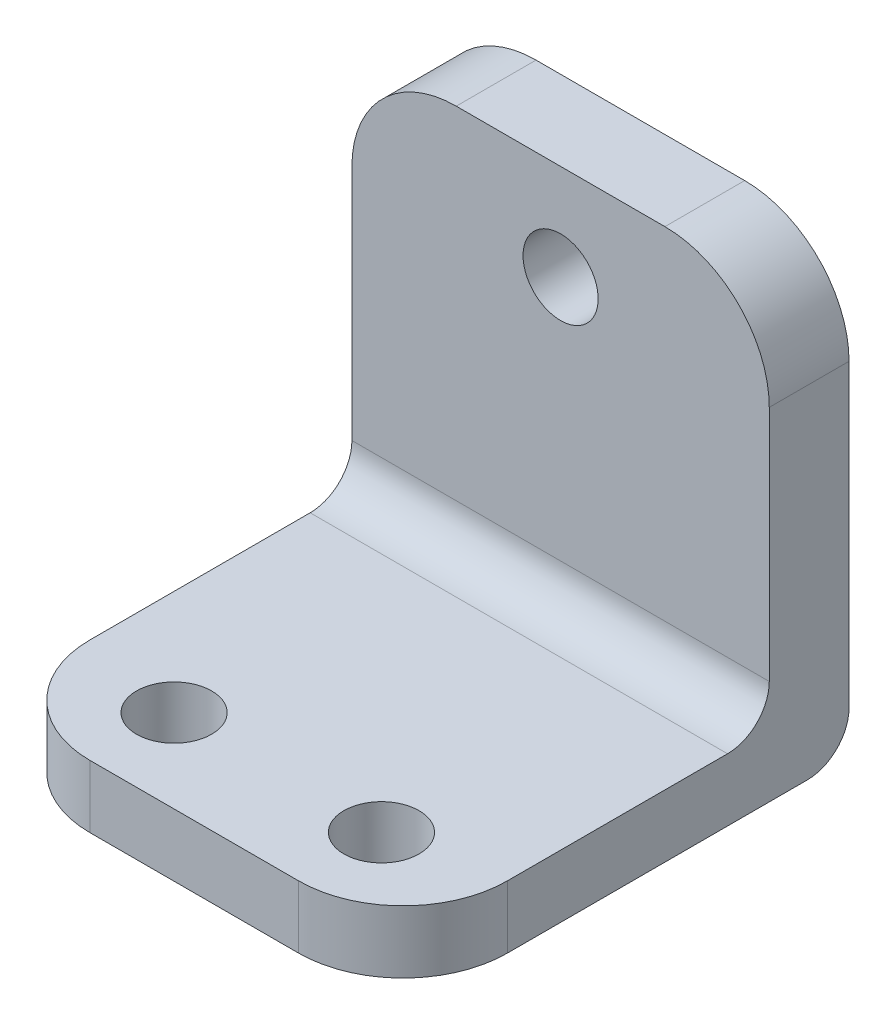
from build123d import *

# Parameters (mm, degrees)
CROQUIS1_W              = 20
CROQUIS1_H              = 21.375
SALIENTE_EXTRUIR1_DEPTH = 3
CROQUIS2_W              = 20
CROQUIS2_H              = 3.823238442
SALIENTE_EXTRUIR2_DEPTH = 18.375
CROQUIS3_R              = 1.8
CORTAR_EXTRUIR1_DEPTH   = 20
CROQUIS4_R              = 1.8
CORTAR_EXTRUIR2_DEPTH   = 20
REDONDEO1_R             = 5
REDONDEO2_R             = 2


with BuildPart() as part:
    # Croquis1 → Saliente-Extruir1 (new body)
    with BuildSketch(Plane(origin=(0, 0, 0), x_dir=(1, 0, 0), z_dir=(0, 1, 0))):
        Rectangle(CROQUIS1_W, CROQUIS1_H)
    extrude(amount=SALIENTE_EXTRUIR1_DEPTH)

    # Croquis2 → Saliente-Extruir2 (add)
    with BuildSketch(Plane(origin=(0, 3, 0), x_dir=(1, 0, 0), z_dir=(0, 1, 0))):
        with Locations((0, 8.775880779)):
            Rectangle(CROQUIS2_W, CROQUIS2_H)
    extrude(amount=SALIENTE_EXTRUIR2_DEPTH)

    # Croquis3 → Cortar-Extruir1 (cut)
    with BuildSketch(Plane.XZ):
        with Locations((4.968918063, 6.6875)):
            Circle(CROQUIS3_R)
        with Locations((-4.968918063, 6.6875)):
            Circle(CROQUIS3_R)
    extrude(amount=-CORTAR_EXTRUIR1_DEPTH, mode=Mode.SUBTRACT)

    # Croquis4 → Cortar-Extruir2 (cut)
    with BuildSketch(Plane(origin=(0, 0, -10.6875), x_dir=(-1, 0, 0), z_dir=(0, 0, -1))):
        with Locations((0, 16.777265896)):
            Circle(CROQUIS4_R)
    extrude(amount=-CORTAR_EXTRUIR2_DEPTH, mode=Mode.SUBTRACT)

    # Redondeo1
    redondeo1_edges = [part.edges().sort_by_distance(p)[0] for p in [
        (-10, 21.375, -8.775880779),
        (10, 1.5, 10.6875),
        (-10, 1.5, 10.6875),
        (10, 21.375, -8.775880779),
    ]]
    fillet(redondeo1_edges, radius=REDONDEO1_R)

    # Redondeo2
    redondeo2_edges = [part.edges().sort_by_distance(p)[0] for p in [
        (0, 3, -6.864261558),
        (0, 0, -10.6875),
    ]]
    fillet(redondeo2_edges, radius=REDONDEO2_R)


solid = part.part
